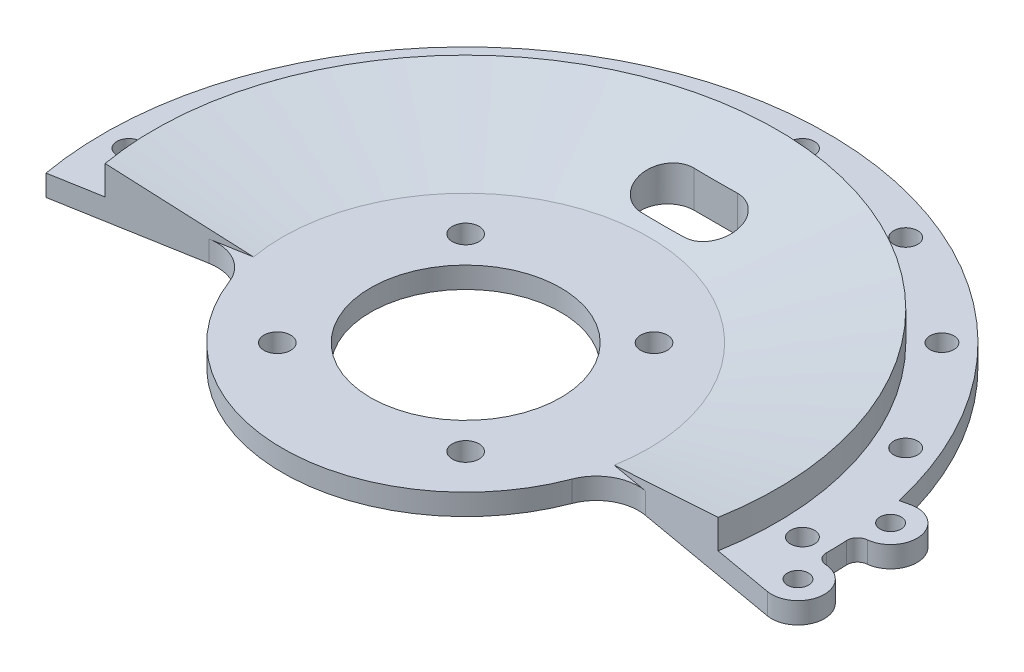
from build123d import *

# Parameters (mm, degrees)
SKETCH1_R           = 1.8
SKETCH1_R_2         = 2
SKETCH1_R_3         = 14.2875
BOSS_EXTRUDE1_DEPTH = 3.175
REVOLVE3_ANGLE      = 200
BOSS_EXTRUDE2_START = -3.175
SKETCH3_R           = 1.5875
BOSS_EXTRUDE2_DEPTH = 3.175
CUT_EXTRUDE1_DEPTH  = 81.857095427


# Read off the part's stored shape, not the designer's step: Revolve3
with BuildPart() as part:
    # Sketch1 → Boss-Extrude1 (new body)
    with BuildSketch(Plane(origin=(0, 0, 0), x_dir=(1, 0, 0), z_dir=(0, 1, 0))):
        with BuildLine():
            Line((53.576531883, -9.446988104), (32.743932203, -5.773638702))
            ThreePointArc((32.743932203, -5.773638702), (28.505328465, -6.505538278), (25.705607757, -9.770963609))
            ThreePointArc((25.705607757, -9.770963609), (0, -27.5), (-25.705607757, -9.770963609))
            ThreePointArc((-25.705607757, -9.770963609), (-28.505328465, -6.505538278), (-32.743932203, -5.773638702))
            Line((-32.743932203, -5.773638702), (-53.576531883, -9.446988104))
            ThreePointArc((-53.576531883, -9.446988104), (0, 54.403036246), (53.576531883, -9.446988104))
        make_face()
        with Locations(Location((-50.569518123, 0, 0), (0, 0, 270))):
            Circle(SKETCH1_R, mode=Mode.SUBTRACT)
        with Locations(Location((-46.720142763, 19.352116768, 0), (0, 0, 270))):
            Circle(SKETCH1_R, mode=Mode.SUBTRACT)
        with Locations(Location((-35.758049186, 35.758049186, 0), (0, 0, 270))):
            Circle(SKETCH1_R, mode=Mode.SUBTRACT)
        with Locations(Location((-19.352116768, 46.720142763, 0), (0, 0, 270))):
            Circle(SKETCH1_R, mode=Mode.SUBTRACT)
        with Locations(Location((0, 50.569518123, 0), (0, 0, 270))):
            Circle(SKETCH1_R, mode=Mode.SUBTRACT)
        with Locations(Location((19.352116768, 46.720142763, 0), (0, 0, 270))):
            Circle(SKETCH1_R, mode=Mode.SUBTRACT)
        with Locations(Location((35.758049186, 35.758049186, 0), (0, 0, 270))):
            Circle(SKETCH1_R, mode=Mode.SUBTRACT)
        with Locations(Location((46.720142763, 19.352116768, 0), (0, 0, 270))):
            Circle(SKETCH1_R, mode=Mode.SUBTRACT)
        with Locations(Location((50.569518123, 0, 0), (0, 0, 270))):
            Circle(SKETCH1_R, mode=Mode.SUBTRACT)
        with Locations(Location((14.142135624, 14.142135624, 0), (0, 0, 270))):
            Circle(SKETCH1_R_2, mode=Mode.SUBTRACT)
        with Locations(Location((-14.142135624, 14.142135624, 0), (0, 0, 270))):
            Circle(SKETCH1_R_2, mode=Mode.SUBTRACT)
        with Locations(Location((-14.142135624, -14.142135624, 0), (0, 0, 270))):
            Circle(SKETCH1_R_2, mode=Mode.SUBTRACT)
        with Locations(Location((14.142135624, -14.142135624, 0), (0, 0, 270))):
            Circle(SKETCH1_R_2, mode=Mode.SUBTRACT)
        with Locations(Location((0, 0, 0), (0, 0, 270))):
            Circle(SKETCH1_R_3, mode=Mode.SUBTRACT)
        with BuildLine():
            Line((-3.25, 37.54875), (3.25, 37.54875))
            ThreePointArc((3.25, 37.54875), (7.21875, 33.58), (3.25, 29.61125))
            Line((3.25, 29.61125), (-3.25, 29.61125))
            ThreePointArc((-3.25, 29.61125), (-7.21875, 33.58), (-3.25, 37.54875))
        make_face(mode=Mode.SUBTRACT)
    extrude(amount=-BOSS_EXTRUDE1_DEPTH)

    # Revolve3 outline → Revolve3 (revolve)
    with BuildSketch(Plane(origin=(0, 0, 0), x_dir=(0.9848077530122042, 0, 0.1736481776669518), z_dir=(-0.1736481776669518, 0, 0.9848077530122042))):
        Polygon((46.736, 0), (46.736, 4.35512275), (27.5, 0), align=None)
    revolve(axis=Axis((0, 0, 0), (0, 1, 0)), revolution_arc=REVOLVE3_ANGLE)

    # Sketch3 → Boss-Extrude2 (add)
    with BuildSketch(Plane.XZ.offset(3.175).offset(BOSS_EXTRUDE2_START)):
        with BuildLine():
            Line((53.060117126, -12.013089669), (54.471072105, -12.3325373))
            ThreePointArc((54.471072105, -12.3325373), (59.259341774, -9.131069871), (55.807809409, -4.519796246))
            ThreePointArc((55.807809409, -4.519796246), (54.72616849, -3.989558211), (54.328198384, -2.85258009))
            ThreePointArc((54.328198384, -2.85258009), (54.387291369, -1.308774374), (54.402523984, 0.236086798))
            ThreePointArc((54.402523984, 0.236086798), (54.854722203, 1.352606489), (55.960615645, 1.830203754))
            ThreePointArc((55.960615645, 1.830203754), (59.629955631, 6.270120891), (55.001219172, 9.698198912))
            Line((55.001219172, 9.698198912), (53.576531883, 9.446988104))
            Line((53.576531883, 9.446988104), (53.060117126, -12.013089669))
        make_face()
        with Locations(Location((55.690385377, 5.789743142, 0), (0, 0, 270))):
            Circle(SKETCH3_R, mode=Mode.SUBTRACT)
        with Locations(Location((55.347437708, -8.461754447, 0), (0, 0, 270))):
            Circle(SKETCH3_R, mode=Mode.SUBTRACT)
    extrude(amount=BOSS_EXTRUDE2_DEPTH)

    # Sketch4 → Cut-Extrude1 (cut, through all)
    with BuildSketch(Plane.XZ):
        with BuildLine():
            Line((-3.25, -37.54875), (3.25, -37.54875))
            ThreePointArc((3.25, -37.54875), (7.21875, -33.58), (3.25, -29.61125))
            Line((3.25, -29.61125), (-3.25, -29.61125))
            ThreePointArc((-3.25, -29.61125), (-7.21875, -33.58), (-3.25, -37.54875))
        make_face()
    extrude(amount=-CUT_EXTRUDE1_DEPTH, mode=Mode.SUBTRACT)


solid = part.part
